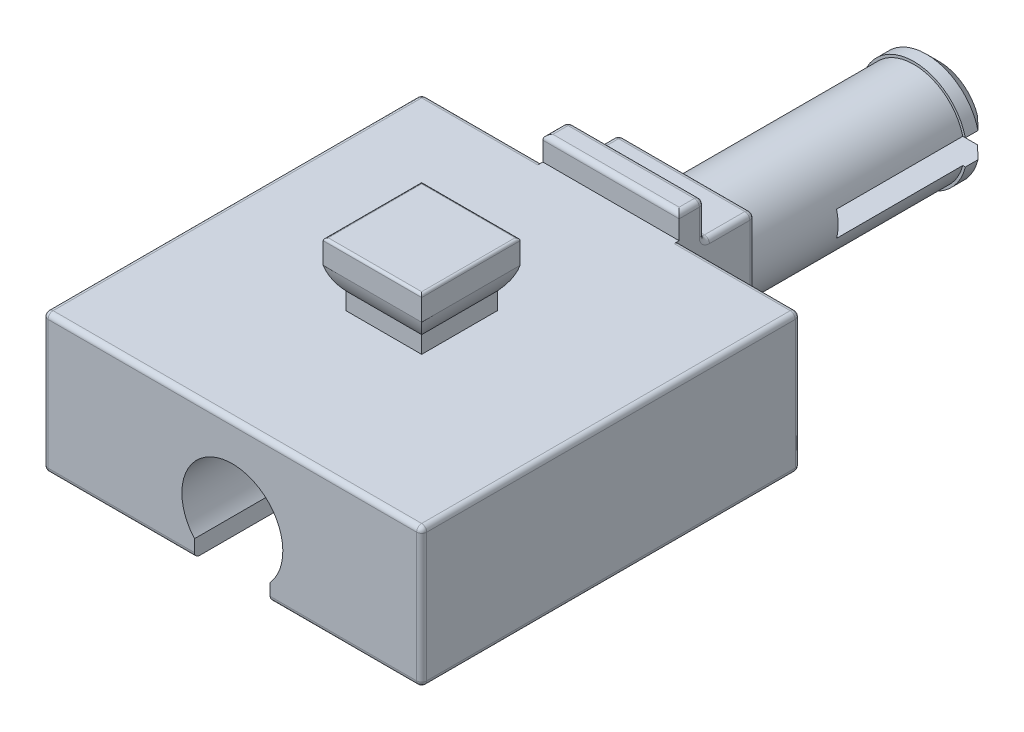
from build123d import *

# Parameters (mm, degrees)
SKETCH_1_W               = 15
SKETCH_1_H               = 15
EXTRUDE_1_DEPTH          = 5.5
CUT_EXTRUDE_1_DEPTH      = 11
EXTRUDE_2_DEPTH          = 2
EXTRUDE_2_DEPTH_BACK     = 2
CUT_EXTRUDE_2_DEPTH      = 2
CUT_EXTRUDE_2_DEPTH_BACK = 2
SKETCH_5_W               = 5.4
SKETCH_5_H               = 7.4
EXTRUDE_3_DEPTH          = 1
SKETCH_6_W               = 5.4
SKETCH_6_H               = 5
EXTRUDE_4_DEPTH          = 2
SKETCH_7_R               = 2
EXTRUDE_5_DEPTH          = 10
SKETCH_8_R               = 2.1
EXTRUDE_6_DEPTH          = 1
CHAMFER_1_SIZE           = 0.5
SKETCH_9_W               = 5
SKETCH_9_H               = 1
CUT_EXTRUDE_3_DEPTH      = 6
FILLET_1_R               = 0.1
FILLET_2_R               = 0.2


with BuildPart() as part:
    # 草图1 → 凸台-拉伸1 (new body)
    with BuildSketch(Plane(origin=(0, 0, 0), x_dir=(1, 0, 0), z_dir=(0, 1, 0))):
        Rectangle(SKETCH_1_W, SKETCH_1_H)
    extrude(amount=EXTRUDE_1_DEPTH)

    # 草图2 → 切除-拉伸1 (cut)
    with BuildSketch(Plane.XY.offset(7.5)):
        with BuildLine():
            Line((1.5, 0), (-1.5, 0))
            Line((-1.5, 0), (-1.5, 0.677124344))
            ThreePointArc((-1.5, 0.677124344), (0, 4), (1.5, 0.677124344))
            Line((1.5, 0.677124344), (1.5, 0))
        make_face()
    extrude(amount=-CUT_EXTRUDE_1_DEPTH, mode=Mode.SUBTRACT)

    # 草图3 → 凸台-拉伸2 (add, two sides: drawn at the far end of the back side and taken through both)
    with BuildSketch(Plane.XY.offset(-EXTRUDE_2_DEPTH_BACK)):
        with BuildLine():
            Line((1.5, 5.5), (-1.5, 5.5))
            Line((-1.5, 5.5), (-1.5, 6.177124344))
            ThreePointArc((-1.5, 6.177124344), (-1.780042303, 6.588161527), (-1.95, 7.055590279))
            Line((-1.95, 7.055590279), (-1.95, 8))
            Line((-1.95, 8), (1.95, 8))
            Line((1.95, 8), (1.95, 7.055590279))
            ThreePointArc((1.95, 7.055590279), (1.780042303, 6.588161527), (1.5, 6.177124344))
            Line((1.5, 6.177124344), (1.5, 5.5))
        make_face()
    extrude(amount=EXTRUDE_2_DEPTH + EXTRUDE_2_DEPTH_BACK)

    # 草图4 → 切除-拉伸2 (cut, two sides: drawn at the far end of the back side and taken through both)
    with BuildSketch(Plane(origin=(0, 0, 0), x_dir=(0, 0, -1), z_dir=(1, 0, 0)).offset(-CUT_EXTRUDE_2_DEPTH_BACK)):
        with BuildLine():
            Line((-1.5, 5.5), (-1.5, 6.177124344))
            ThreePointArc((-1.5, 6.177124344), (-1.780042303, 6.588161527), (-1.95, 7.055590279))
            Line((-1.95, 7.055590279), (-1.95, 8))
            Line((-1.95, 8), (-2, 8))
            Line((-2, 8), (-2, 5.5))
            Line((-2, 5.5), (-1.5, 5.5))
        make_face()
        with BuildLine():
            Line((2, 5.5), (1.5, 5.5))
            Line((1.5, 5.5), (1.5, 6.177124344))
            ThreePointArc((1.5, 6.177124344), (1.780042303, 6.588161527), (1.95, 7.055590279))
            Line((1.95, 7.055590279), (1.95, 8))
            Line((1.95, 8), (2, 8))
            Line((2, 8), (2, 5.5))
        make_face()
    extrude(amount=CUT_EXTRUDE_2_DEPTH + CUT_EXTRUDE_2_DEPTH_BACK, mode=Mode.SUBTRACT)

    # 草图5 → 凸台-拉伸3 (add)
    with BuildSketch(Plane(origin=(0, 0, -7.5), x_dir=(-1, 0, 0), z_dir=(0, 0, -1))):
        with Locations((0, 2.75)):
            Rectangle(SKETCH_5_W, SKETCH_5_H)
    extrude(amount=EXTRUDE_3_DEPTH)

    # 草图6 → 凸台-拉伸4 (add)
    with BuildSketch(Plane(origin=(0, 0, -8.5), x_dir=(-1, 0, 0), z_dir=(0, 0, -1))):
        with Locations((0, 2.5)):
            Rectangle(SKETCH_6_W, SKETCH_6_H)
    extrude(amount=EXTRUDE_4_DEPTH)

    # 草图7 → 凸台-拉伸5 (add)
    with BuildSketch(Plane(origin=(0, 0, -10.5), x_dir=(-1, 0, 0), z_dir=(0, 0, -1))):
        with Locations(Location((0, 2.2, 0), (0, 0, 180))):
            Circle(SKETCH_7_R)
    extrude(amount=EXTRUDE_5_DEPTH)

    # 草图8 → 凸台-拉伸6 (add)
    with BuildSketch(Plane(origin=(0, 0, -20.5), x_dir=(-1, 0, 0), z_dir=(0, 0, -1))):
        with Locations((0, 2.2)):
            Circle(SKETCH_8_R)
    extrude(amount=-EXTRUDE_6_DEPTH)

    # 倒角1
    chamfer_1_edges = [part.edges().sort_by_distance(p)[0] for p in [
        (2.1, 2.2, -20.5),
    ]]
    chamfer(chamfer_1_edges, length=CHAMFER_1_SIZE)

    # 草图9 → 切除-拉伸3 (cut)
    with BuildSketch(Plane(origin=(0, 0, -20.5), x_dir=(-1, 0, 0), z_dir=(0, 0, -1))):
        with Locations((0, 2.2)):
            Rectangle(SKETCH_9_W, SKETCH_9_H)
    extrude(amount=-CUT_EXTRUDE_3_DEPTH, mode=Mode.SUBTRACT)

    # 圆角1
    fillet_1_edges = [part.edges().sort_by_distance(p)[0] for p in [
        (1.95, 8, 0),
        (-1.95, 8, 0),
        (0, 8, -1.95),
        (0, 8, 1.95),
    ]]
    fillet(fillet_1_edges, radius=FILLET_1_R)

    # 圆角2
    fillet_2_edges = [part.edges().sort_by_distance(p)[0] for p in [
        (0, 5.5, 7.5),
        (-5.1, 0, -7.5),
        (-5.1, 5.5, -7.5),
        (-2.7, -0.95, -8),
        (0, 6.45, -7.5),
        (-2.7, 6.45, -8),
        (2.7, 6.45, -8),
        (0, -0.95, -7.5),
        (2.7, -0.95, -8),
        (-2.7, -0.475, -8.5),
        (0, 6.45, -8.5),
        (2.7, 5.725, -8.5),
        (0, -0.95, -8.5),
        (7.5, 5.5, 0),
        (-2.7, 5.725, -8.5),
        (2.7, -0.475, -8.5),
        (4.5, 0, 7.5),
        (2.7, 5, -9.5),
        (0, 0, -8.5),
        (2.7, 0, -9.5),
        (-2.7, 0, -9.5),
        (0, 5, -8.5),
        (-2.7, 5, -9.5),
        (2.7, 2.5, -10.5),
        (0, 0, -10.5),
        (-2.7, 2.5, -10.5),
        (0, 5, -10.5),
        (5.1, 5.5, -7.5),
        (7.5, 0, 0),
        (-4.5, 0, 7.5),
        (-7.5, 0, 0),
        (5.1, 0, -7.5),
        (-7.5, 5.5, 0),
        (7.5, 2.75, -7.5),
        (7.5, 2.75, 7.5),
        (-7.5, 2.75, 7.5),
        (-7.5, 2.75, -7.5),
    ]]
    fillet(fillet_2_edges, radius=FILLET_2_R - 0.0001)  # a hair under: the kernel refuses the full size


solid = part.part
